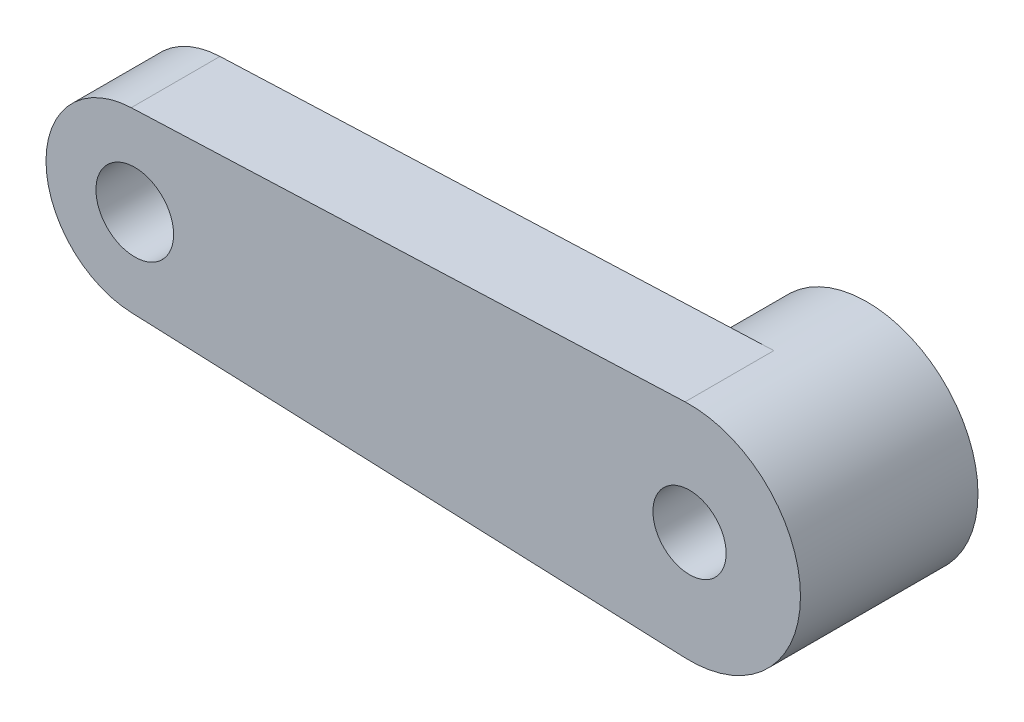
from build123d import *
from build123d.topology import SkipClean

# Parameters (mm, degrees)
SKETCH1_R           = 5
BOSS_EXTRUDE1_DEPTH = 4
SKETCH2_R           = 1.65
SKETCH2_R_2         = 1.75
BOSS_EXTRUDE2_DEPTH = 4


with BuildPart() as part:
    # Sketch1 → Boss-Extrude1 (new body)
    with BuildSketch(Plane.XY):
        Circle(SKETCH1_R)
        with BuildLine():
            Line((0.230810939, 2.825076686), (0.169592064, 2.745294695))
            Line((0.169592064, 2.745294695), (0.121151994, 2.829195356))
            ThreePointArc((0.121151994, 2.829195356), (-0.003908933, 2.911590561), (-0.137917489, 2.844725679))
            Line((-0.137917489, 2.844725679), (-0.190155863, 2.75424616))
            Line((-0.190155863, 2.75424616), (-0.251374738, 2.834028151))
            ThreePointArc((-0.251374738, 2.834028151), (-0.389956668, 2.891430666), (-0.508959669, 2.800116452))
            Line((-0.508959669, 2.800116452), (-0.547443463, 2.707208355))
            Line((-0.547443463, 2.707208355), (-0.618552241, 2.778317134))
            ThreePointArc((-0.618552241, 2.778317134), (-0.763441115, 2.817139991), (-0.869507132, 2.711073973))
            Line((-0.869507132, 2.711073973), (-0.895534752, 2.613937576))
            Line((-0.895534752, 2.613937576), (-0.975316743, 2.675156451))
            ThreePointArc((-0.975316743, 2.675156451), (-1.124033472, 2.694735379), (-1.215347686, 2.575732378))
            Line((-1.215347686, 2.575732378), (-1.228473792, 2.47602971))
            Line((-1.228473792, 2.47602971), (-1.315563903, 2.526311209))
            ThreePointArc((-1.315563903, 2.526311209), (-1.465563903, 2.526311209), (-1.540563903, 2.396407399))
            Line((-1.540563903, 2.396407399), (-1.540563903, 2.2958444))
            Line((-1.540563903, 2.2958444), (-1.633472, 2.334328193))
            ThreePointArc((-1.633472, 2.334328193), (-1.782188729, 2.314749265), (-1.839591244, 2.176167335))
            Line((-1.839591244, 2.176167335), (-1.826465138, 2.076464666))
            Line((-1.826465138, 2.076464666), (-1.923601536, 2.102492286))
            ThreePointArc((-1.923601536, 2.102492286), (-2.06849041, 2.063669429), (-2.107313267, 1.918780555))
            Line((-2.107313267, 1.918780555), (-2.081285648, 1.821644157))
            Line((-2.081285648, 1.821644157), (-2.180988316, 1.834770262))
            ThreePointArc((-2.180988316, 1.834770262), (-2.319570246, 1.777367747), (-2.339149175, 1.628651018))
            Line((-2.339149175, 1.628651018), (-2.300665381, 1.535742922))
            Line((-2.300665381, 1.535742922), (-2.40122838, 1.535742922))
            ThreePointArc((-2.40122838, 1.535742922), (-2.531132191, 1.460742922), (-2.531132191, 1.310742922))
            Line((-2.531132191, 1.310742922), (-2.480850691, 1.22365281))
            Line((-2.480850691, 1.22365281), (-2.58055336, 1.210526705))
            ThreePointArc((-2.58055336, 1.210526705), (-2.699556361, 1.11921249), (-2.679977432, 0.970495761))
            Line((-2.679977432, 0.970495761), (-2.618758557, 0.89071377))
            Line((-2.618758557, 0.89071377), (-2.715894955, 0.864686151))
            ThreePointArc((-2.715894955, 0.864686151), (-2.821960972, 0.758620134), (-2.783138115, 0.61373126))
            Line((-2.783138115, 0.61373126), (-2.712029337, 0.542622481))
            Line((-2.712029337, 0.542622481), (-2.804937433, 0.504138688))
            ThreePointArc((-2.804937433, 0.504138688), (-2.896251648, 0.385135687), (-2.838849133, 0.246553757))
            Line((-2.838849133, 0.246553757), (-2.759067142, 0.185334882))
            Line((-2.759067142, 0.185334882), (-2.846157253, 0.135053382))
            ThreePointArc((-2.846157253, 0.135053382), (-2.921157253, 0.005149572), (-2.846157253, -0.124754239))
            Line((-2.846157253, -0.124754239), (-2.759067142, -0.175035738))
            Line((-2.759067142, -0.175035738), (-2.838849133, -0.236254613))
            ThreePointArc((-2.838849133, -0.236254613), (-2.896251648, -0.374836543), (-2.804937433, -0.493839544))
            Line((-2.804937433, -0.493839544), (-2.712029337, -0.532323338))
            Line((-2.712029337, -0.532323338), (-2.783138115, -0.603432116))
            ThreePointArc((-2.783138115, -0.603432116), (-2.821960972, -0.74832099), (-2.715894955, -0.854387007))
            Line((-2.715894955, -0.854387007), (-2.618758557, -0.880414626))
            Line((-2.618758557, -0.880414626), (-2.679977432, -0.960196618))
            ThreePointArc((-2.679977432, -0.960196618), (-2.699556361, -1.108913347), (-2.58055336, -1.200227561))
            Line((-2.58055336, -1.200227561), (-2.480850691, -1.213353666))
            Line((-2.480850691, -1.213353666), (-2.531132191, -1.300443778))
            ThreePointArc((-2.531132191, -1.300443778), (-2.531132191, -1.450443778), (-2.40122838, -1.525443778))
            Line((-2.40122838, -1.525443778), (-2.300665381, -1.525443778))
            Line((-2.300665381, -1.525443778), (-2.339149175, -1.618351875))
            ThreePointArc((-2.339149175, -1.618351875), (-2.319570246, -1.767068604), (-2.180988316, -1.824471119))
            Line((-2.180988316, -1.824471119), (-2.081285648, -1.811345013))
            Line((-2.081285648, -1.811345013), (-2.107313267, -1.908481411))
            ThreePointArc((-2.107313267, -1.908481411), (-2.06849041, -2.053370285), (-1.923601536, -2.092193142))
            Line((-1.923601536, -2.092193142), (-1.826465138, -2.066165522))
            Line((-1.826465138, -2.066165522), (-1.839591244, -2.165868191))
            ThreePointArc((-1.839591244, -2.165868191), (-1.782188729, -2.304450121), (-1.633472, -2.32402905))
            Line((-1.633472, -2.32402905), (-1.540563903, -2.285545256))
            Line((-1.540563903, -2.285545256), (-1.540563903, -2.386108255))
            ThreePointArc((-1.540563903, -2.386108255), (-1.465563903, -2.516012066), (-1.315563903, -2.516012066))
            Line((-1.315563903, -2.516012066), (-1.228473792, -2.465730566))
            Line((-1.228473792, -2.465730566), (-1.215347686, -2.565433235))
            ThreePointArc((-1.215347686, -2.565433235), (-1.124033472, -2.684436236), (-0.975316743, -2.664857307))
            Line((-0.975316743, -2.664857307), (-0.895534752, -2.603638432))
            Line((-0.895534752, -2.603638432), (-0.869507132, -2.70077483))
            ThreePointArc((-0.869507132, -2.70077483), (-0.763441115, -2.806840847), (-0.618552241, -2.76801799))
            Line((-0.618552241, -2.76801799), (-0.547443463, -2.696909212))
            Line((-0.547443463, -2.696909212), (-0.508959669, -2.789817308))
            ThreePointArc((-0.508959669, -2.789817308), (-0.389956668, -2.881131522), (-0.251374738, -2.823729008))
            Line((-0.251374738, -2.823729008), (-0.190155863, -2.743947016))
            Line((-0.190155863, -2.743947016), (-0.139874364, -2.831037128))
            ThreePointArc((-0.139874364, -2.831037128), (-0.009970553, -2.906037128), (0.119933257, -2.831037128))
            Line((0.119933257, -2.831037128), (0.170214757, -2.743947016))
            Line((0.170214757, -2.743947016), (0.231433632, -2.823729008))
            ThreePointArc((0.231433632, -2.823729008), (0.370015562, -2.881131522), (0.489018563, -2.789817308))
            Line((0.489018563, -2.789817308), (0.527502356, -2.696909212))
            Line((0.527502356, -2.696909212), (0.598611135, -2.76801799))
            ThreePointArc((0.598611135, -2.76801799), (0.743500009, -2.806840847), (0.849566026, -2.70077483))
            Line((0.849566026, -2.70077483), (0.875593645, -2.603638432))
            Line((0.875593645, -2.603638432), (0.955375636, -2.664857307))
            ThreePointArc((0.955375636, -2.664857307), (1.104092365, -2.684436236), (1.19540658, -2.565433235))
            Line((1.19540658, -2.565433235), (1.208532685, -2.465730566))
            Line((1.208532685, -2.465730566), (1.295622797, -2.516012066))
            ThreePointArc((1.295622797, -2.516012066), (1.445622797, -2.516012066), (1.520622797, -2.386108255))
            Line((1.520622797, -2.386108255), (1.520622797, -2.285545256))
            Line((1.520622797, -2.285545256), (1.613530893, -2.32402905))
            ThreePointArc((1.613530893, -2.32402905), (1.762247622, -2.304450121), (1.819650137, -2.165868191))
            Line((1.819650137, -2.165868191), (1.806524032, -2.066165522))
            Line((1.806524032, -2.066165522), (1.90366043, -2.092193142))
            ThreePointArc((1.90366043, -2.092193142), (2.048549304, -2.053370285), (2.08737216, -1.908481411))
            Line((2.08737216, -1.908481411), (2.061344541, -1.811345013))
            Line((2.061344541, -1.811345013), (2.16104721, -1.824471119))
            ThreePointArc((2.16104721, -1.824471119), (2.299629139, -1.767068604), (2.319208068, -1.618351875))
            Line((2.319208068, -1.618351875), (2.280724275, -1.525443778))
            Line((2.280724275, -1.525443778), (2.381287274, -1.525443778))
            ThreePointArc((2.381287274, -1.525443778), (2.511191084, -1.450443778), (2.511191084, -1.300443778))
            Line((2.511191084, -1.300443778), (2.460909585, -1.213353666))
            Line((2.460909585, -1.213353666), (2.560612253, -1.200227561))
            ThreePointArc((2.560612253, -1.200227561), (2.679615254, -1.108913347), (2.660036325, -0.960196618))
            Line((2.660036325, -0.960196618), (2.598817451, -0.880414626))
            Line((2.598817451, -0.880414626), (2.695953848, -0.854387007))
            ThreePointArc((2.695953848, -0.854387007), (2.802019865, -0.74832099), (2.763197009, -0.603432116))
            Line((2.763197009, -0.603432116), (2.69208823, -0.532323338))
            Line((2.69208823, -0.532323338), (2.784996327, -0.493839544))
            ThreePointArc((2.784996327, -0.493839544), (2.876310541, -0.374836543), (2.818908026, -0.236254613))
            Line((2.818908026, -0.236254613), (2.739126035, -0.175035738))
            Line((2.739126035, -0.175035738), (2.83148471, -0.121712432))
            ThreePointArc((2.83148471, -0.121712432), (2.894400551, 0.001114226), (2.830352473, 0.123354296))
            Line((2.830352473, 0.123354296), (2.738503342, 0.176383417))
            Line((2.738503342, 0.176383417), (2.818285333, 0.237602291))
            ThreePointArc((2.818285333, 0.237602291), (2.875687848, 0.376184221), (2.784373634, 0.495187222))
            Line((2.784373634, 0.495187222), (2.691465537, 0.533671016))
            Line((2.691465537, 0.533671016), (2.762574316, 0.604779794))
            ThreePointArc((2.762574316, 0.604779794), (2.801397173, 0.749668668), (2.695331155, 0.855734686))
            Line((2.695331155, 0.855734686), (2.598194758, 0.881762305))
            Line((2.598194758, 0.881762305), (2.659413632, 0.961544296))
            ThreePointArc((2.659413632, 0.961544296), (2.678992561, 1.110261025), (2.55998956, 1.20157524))
            Line((2.55998956, 1.20157524), (2.460286892, 1.214701345))
            Line((2.460286892, 1.214701345), (2.510568391, 1.301791457))
            ThreePointArc((2.510568391, 1.301791457), (2.510568391, 1.451791457), (2.380664581, 1.526791457))
            Line((2.380664581, 1.526791457), (2.280101582, 1.526791457))
            Line((2.280101582, 1.526791457), (2.318585375, 1.619699553))
            ThreePointArc((2.318585375, 1.619699553), (2.299006446, 1.768416282), (2.160424517, 1.825818797))
            Line((2.160424517, 1.825818797), (2.060721848, 1.812692692))
            Line((2.060721848, 1.812692692), (2.086749467, 1.90982909))
            ThreePointArc((2.086749467, 1.90982909), (2.047926611, 2.054717963), (1.903037737, 2.09354082))
            Line((1.903037737, 2.09354082), (1.805901339, 2.067513201))
            Line((1.805901339, 2.067513201), (1.819027444, 2.167215869))
            ThreePointArc((1.819027444, 2.167215869), (1.761624929, 2.305797799), (1.6129082, 2.325376728))
            Line((1.6129082, 2.325376728), (1.520000104, 2.286892934))
            Line((1.520000104, 2.286892934), (1.520000104, 2.387455933))
            ThreePointArc((1.520000104, 2.387455933), (1.445000104, 2.517359744), (1.295000104, 2.517359744))
            Line((1.295000104, 2.517359744), (1.207909992, 2.467078244))
            Line((1.207909992, 2.467078244), (1.194783887, 2.566780913))
            ThreePointArc((1.194783887, 2.566780913), (1.103469672, 2.685783914), (0.954752943, 2.666204985))
            Line((0.954752943, 2.666204985), (0.874970952, 2.60498611))
            Line((0.874970952, 2.60498611), (0.848943333, 2.702122508))
            ThreePointArc((0.848943333, 2.702122508), (0.742877316, 2.808188525), (0.597988442, 2.769365669))
            Line((0.597988442, 2.769365669), (0.526879663, 2.69825689))
            Line((0.526879663, 2.69825689), (0.48839587, 2.791164986))
            ThreePointArc((0.48839587, 2.791164986), (0.369392869, 2.882479201), (0.230810939, 2.825076686))
        make_face(mode=Mode.SUBTRACT)
    extrude(amount=BOSS_EXTRUDE1_DEPTH)

    # Sketch2 → Boss-Extrude2 (add)
    with SkipClean():  # the faces are left unmerged after this step: merging them gives an invalid solid
        with BuildSketch(Plane.XY.offset(4)):
            with BuildLine():
                Line((-25.16, 3.996798719), (-0.2, 4.995998399))
                ThreePointArc((-0.2, 4.995998399), (5, 0), (-0.2, -4.995998399))
                Line((-0.2, -4.995998399), (-25.16, -3.996798719))
                ThreePointArc((-25.16, -3.996798719), (-29, 0), (-25.16, 3.996798719))
            make_face()
            Circle(SKETCH2_R, mode=Mode.SUBTRACT)
            with Locations((-25, 0)):
                Circle(SKETCH2_R_2, mode=Mode.SUBTRACT)
        extrude(amount=BOSS_EXTRUDE2_DEPTH)
    add(part.part.scale(1), mode=Mode.REPLACE)  # the faces are merged on a copy


solid = part.part
